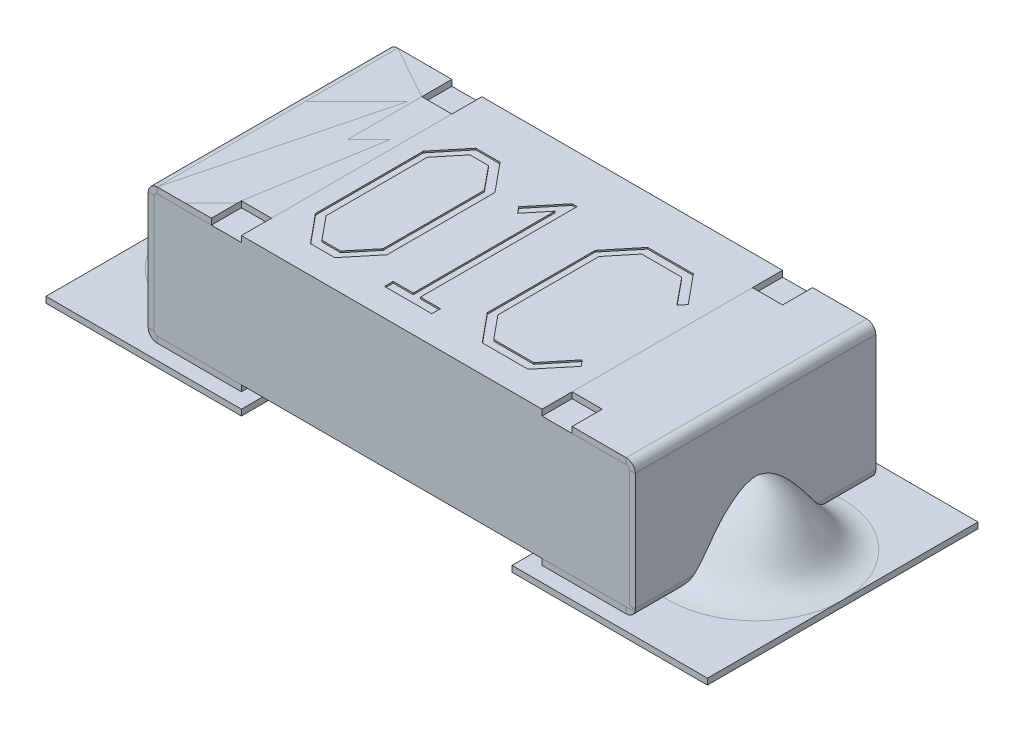
from build123d import *

# Parameters (mm, degrees)
CROQUIS1_W              = 1.6
CROQUIS1_H              = 0.8
SALIENTE_EXTRUIR1_DEPTH = 0.43
CROQUIS5_W              = 0.3
CROQUIS5_H              = 0.8
CORTAR_EXTRUIR1_DEPTH   = 0.02
CROQUIS2_W              = 0.8
CROQUIS2_H              = 0.02
CROQUIS2_2_W            = 0.8
CROQUIS2_2_H            = 0.02
CROQUIS6_W              = 0.1
CROQUIS6_H              = 0.1
CORTAR_EXTRUIR2_DEPTH   = 0.02
CROQUIS7_W              = 0.3
CROQUIS7_H              = 0.8
CORTAR_EXTRUIR3_DEPTH   = 0.02
CORTAR_EXTRUIR4_DEPTH   = 0.005
CROQUIS10_W             = 0.65
CROQUIS10_H             = 0.9
SALIENTE_EXTRUIR2_DEPTH = 0.02


# Read off the part's stored shape, not the designer's step: Revolución1
with BuildPart() as part:
    # Croquis1 → Saliente-Extruir1 (new body)
    with BuildSketch(Plane(origin=(0, 0, 0), x_dir=(1, 0, 0), z_dir=(0, 1, 0))):
        Rectangle(CROQUIS1_W, CROQUIS1_H)
    extrude(amount=SALIENTE_EXTRUIR1_DEPTH)

    # Croquis5 → Cortar-Extruir1 (cut)
    with BuildSketch(Plane(origin=(0, 0.43, 0), x_dir=(1, 0, 0), z_dir=(0, 1, 0))):
        with Locations((-0.65, 0)):
            Rectangle(CROQUIS5_W, CROQUIS5_H)
    extrude(amount=-CORTAR_EXTRUIR1_DEPTH, mode=Mode.SUBTRACT)

    # Cortar-Barrer2: sweep along a path in Croquis3
    with BuildLine(Plane.XY) as cortar_barrer2_path:
        Line((-0.5, 0.42), (-0.78, 0.42))
        ThreePointArc((-0.78, 0.42), (-0.794142136, 0.414142136), (-0.8, 0.4))
        Line((-0.8, 0.4), (-0.8, 0.01))
        ThreePointArc((-0.8, 0.01), (-0.794142136, -0.004142136), (-0.78, -0.01))
        Line((-0.78, -0.01), (-0.5, -0.01))
    # Croquis2 → Cortar-Barrer2 (sweep, cut)
    with BuildSketch(Plane.ZY.offset(0.5)):
        with Locations((0, 0.42)):
            Rectangle(CROQUIS2_W, CROQUIS2_H)
    sweep(path=cortar_barrer2_path.line, mode=Mode.SUBTRACT)

    # Croquis7 → Cortar-Extruir3 (cut)
    with BuildSketch(Plane(origin=(0, 0.43, 0), x_dir=(1, 0, 0), z_dir=(0, 1, 0))):
        with Locations((0.65, 0)):
            Rectangle(CROQUIS7_W, CROQUIS7_H)
    extrude(amount=-CORTAR_EXTRUIR3_DEPTH, mode=Mode.SUBTRACT)

    # Croquis8 → Cortar-Extruir4 (cut)
    # profile 1 of 3: a face of its own
    with BuildSketch(Plane(origin=(0, 0.43, 0), x_dir=(1, 0, 0), z_dir=(0, 1, 0))):
        Polygon((-0.202483801, -0.213282937), (-0.281209503, -0.308423326), (-0.36187905, -0.308423326), (-0.44049676, -0.213282937), (-0.44049676, 0.145788337), (-0.36187905, 0.241576674), (-0.281209503, 0.241576674), (-0.202483801, 0.145788337), align=None)
        Polygon((-0.226565875, -0.201943844), (-0.226565875, 0.134449244), (-0.29049676, 0.212419006), (-0.352591793, 0.212419006), (-0.416414687, 0.134449244), (-0.416414687, -0.201943844), (-0.352591793, -0.279589633), (-0.29049676, -0.279589633), align=None, mode=Mode.SUBTRACT)
    # profile 2 of 3: a face of its own
    with BuildSketch(Plane(origin=(0, 0.43, 0), x_dir=(1, 0, 0), z_dir=(0, 1, 0))):
        Polygon((0.041792657, -0.308423326), (-0.115550756, -0.308423326), (-0.115550756, -0.279589633), (-0.048812095, -0.279589633), (-0.048812095, 0.191684665), (-0.104859611, 0.123542117), (-0.121922246, 0.144276458), (-0.041792657, 0.241576674), (-0.025053996, 0.241576674), (-0.025053996, -0.279589633), (0.041792657, -0.279589633), align=None)
    # profile 3 of 3: a face of its own
    with BuildSketch(Plane(origin=(0, 0.43, 0), x_dir=(1, 0, 0), z_dir=(0, 1, 0))):
        Polygon((0.441792657, -0.211771058), (0.361771058, -0.308423326), (0.209611231, -0.308423326), (0.130993521, -0.213282937), (0.130993521, 0.145788337), (0.209611231, 0.241576674), (0.361771058, 0.241576674), (0.441792657, 0.144276458), (0.424730022, 0.123542117), (0.352159827, 0.212419006), (0.218898488, 0.212419006), (0.155075594, 0.134449244), (0.155075594, -0.201943844), (0.218898488, -0.279589633), (0.352159827, -0.279589633), (0.424730022, -0.191036717), align=None)
    extrude(amount=-CORTAR_EXTRUIR4_DEPTH, mode=Mode.SUBTRACT)


with BuildPart() as body_2:
    # Barrer1: sweep along a path in Croquis3<2>
    with BuildLine(Plane.XY) as barrer1_path:
        Line((-0.5, 0.42), (-0.78, 0.42))
        ThreePointArc((-0.78, 0.42), (-0.794142136, 0.414142136), (-0.8, 0.4))
        Line((-0.8, 0.4), (-0.8, 0.01))
        ThreePointArc((-0.8, 0.01), (-0.794142136, -0.004142136), (-0.78, -0.01))
        Line((-0.78, -0.01), (-0.5, -0.01))
    # Croquis2<2> → Barrer1 (sweep)
    with BuildSketch(Plane.ZY.offset(0.5)):
        with Locations((0, 0.42)):
            Rectangle(CROQUIS2_2_W, CROQUIS2_2_H)
    sweep(path=barrer1_path.line)

    # Croquis6 → Cortar-Extruir2 (cut)
    with BuildSketch(Plane(origin=(0, 0.43, 0), x_dir=(1, 0, 0), z_dir=(0, 1, 0))):
        with Locations((-0.55, -0.35)):
            Rectangle(CROQUIS6_W, CROQUIS6_H)
        with Locations((-0.55, 0.35)):
            Rectangle(CROQUIS6_W, CROQUIS6_H)
    extrude(amount=-CORTAR_EXTRUIR2_DEPTH, mode=Mode.SUBTRACT)


with BuildPart() as body_3:
    # Simetría4: mirrored copy
    add(body_2.part.mirror(Plane(origin=(0, 0, 0), x_dir=(0, 0, 1), z_dir=(1, 0, 0))))

    # Croquis10 → Saliente-Extruir2 (add)
    with BuildSketch(Plane.XZ.offset(0.02)):
        with Locations((0.775, 0)):
            Rectangle(CROQUIS10_W, CROQUIS10_H)
    extrude(amount=SALIENTE_EXTRUIR2_DEPTH)


with BuildPart() as body_4:
    # Revolución1 outline → Revolución1 (revolve)
    with BuildSketch(Plane(origin=(0.81, 0, 0), x_dir=(1, 0, 0), z_dir=(0, 0, 1))):
        with BuildLine():
            Line((0, -0.02), (0.29, -0.02))
            add(Edge.make_bspline(
                [(0.29, -0.02), (0.233020144, -0.02), (0.155789366, 0.011440674), (0.188536625, 0.070000696), (0.072556751, 0.192836807), (0, 0.191393605)],
                knots=[0, 0, 0, 0, 0, 0, 1, 1, 1, 1, 1, 1], degree=5))
            Line((0, 0.191393605), (0, -0.02))
        make_face()
    revolve(axis=Axis((0.81, 0, 0), (0, 1, 0)))


with BuildPart() as body_5:
    # Simetría5: mirrored copy
    add(body_4.part.mirror(Plane(origin=(0, 0, 0), x_dir=(0, 0, 1), z_dir=(1, 0, 0))))


with BuildPart() as body_6:
    # Simetr_a5 2: mirrored copy
    add(body_3.part.mirror(Plane(origin=(0, 0, 0), x_dir=(0, 0, 1), z_dir=(1, 0, 0))))


solid = Compound([part.part, body_2.part, body_3.part, body_4.part, body_5.part, body_6.part])
